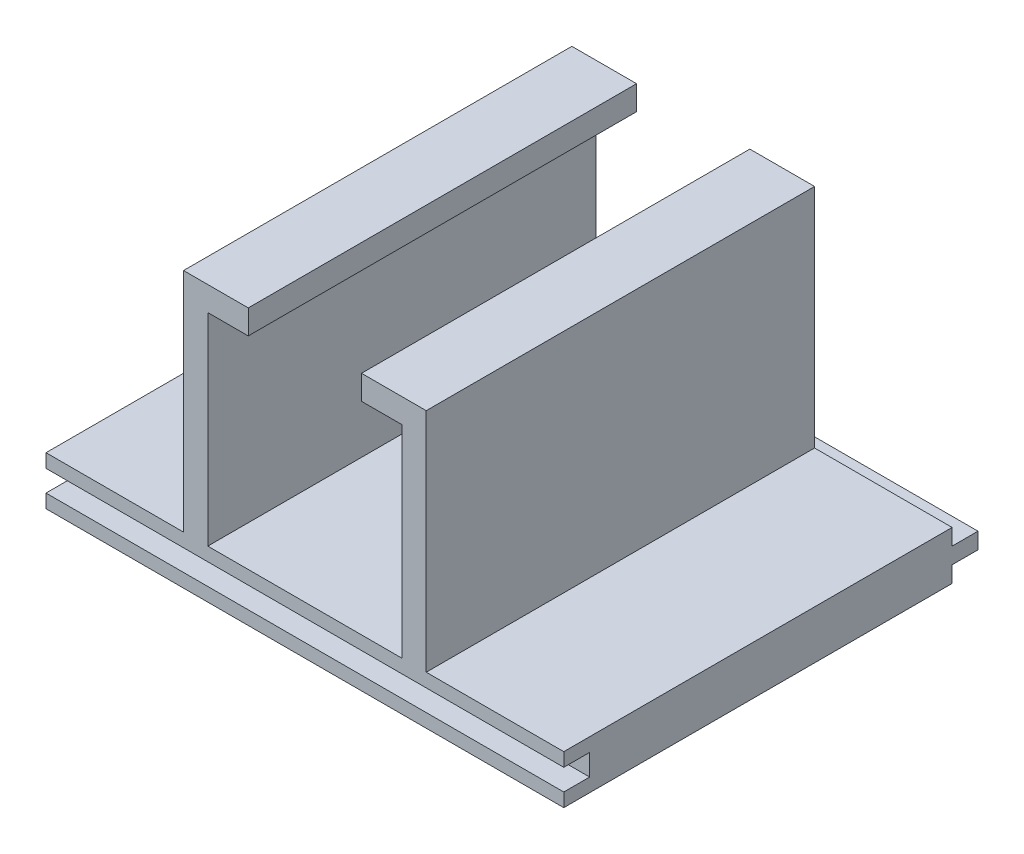
from build123d import *

# Parameters (mm, degrees)
SKETCH1_W           = 101.6
SKETCH1_H           = 76.2
BOSS_EXTRUDE1_DEPTH = 9.525
SKETCH2_W           = 4.7625
SKETCH2_H           = 76.2
BOSS_EXTRUDE2_DEPTH = 44.45
SKETCH3_W           = 76.2
SKETCH3_H           = 4.7625
BOSS_EXTRUDE3_DEPTH = 7.9375
SKETCH5_W           = 101.6
SKETCH5_H           = 4.191
CUT_EXTRUDE1_DEPTH  = 5.08
SKETCH6_W           = 101.6
SKETCH6_H           = 3.175
BOSS_EXTRUDE5_DEPTH = 5.08


with BuildPart() as part:
    # Sketch1 → Boss-Extrude1 (new body)
    with BuildSketch(Plane(origin=(0, 0, 0), x_dir=(1, 0, 0), z_dir=(0, 1, 0))):
        with Locations((50.8, 38.1)):
            Rectangle(SKETCH1_W, SKETCH1_H)
    extrude(amount=BOSS_EXTRUDE1_DEPTH)

    # Sketch2 → Boss-Extrude2 (add)
    with BuildSketch(Plane(origin=(0, 9.525, 0), x_dir=(1, 0, 0), z_dir=(0, 1, 0))):
        with Locations((29.36875, 38.1)):
            Rectangle(SKETCH2_W, SKETCH2_H)
    boss_extrude2 = extrude(amount=BOSS_EXTRUDE2_DEPTH)

    # Sketch3 → Boss-Extrude3 (add)
    with BuildSketch(Plane(origin=(31.75, 0, 0), x_dir=(0, 0, -1), z_dir=(1, 0, 0))):
        with Locations((38.1, 51.59375)):
            Rectangle(SKETCH3_W, SKETCH3_H)
    boss_extrude3 = extrude(amount=BOSS_EXTRUDE3_DEPTH)

    # Sketch5 → Cut-Extrude1 (cut)
    with BuildSketch(Plane.XY):
        with Locations((50.8, 4.7625)):
            Rectangle(SKETCH5_W, SKETCH5_H)
    extrude(amount=-CUT_EXTRUDE1_DEPTH, mode=Mode.SUBTRACT)

    # Sketch6 → Boss-Extrude5 (add)
    with BuildSketch(Plane(origin=(0, 0, -76.2), x_dir=(-1, 0, 0), z_dir=(0, 0, -1))):
        with Locations((-50.8, 4.7625)):
            Rectangle(SKETCH6_W, SKETCH6_H)
    extrude(amount=BOSS_EXTRUDE5_DEPTH)

    # Mirror1: Boss-Extrude2, Boss-Extrude3 across plane
    add(boss_extrude2.mirror(Plane(origin=(50.8, 0, 0), x_dir=(0, 0, 1), z_dir=(1, 0, 0))))
    add(boss_extrude3.mirror(Plane(origin=(50.8, 0, 0), x_dir=(0, 0, 1), z_dir=(1, 0, 0))))


solid = part.part
